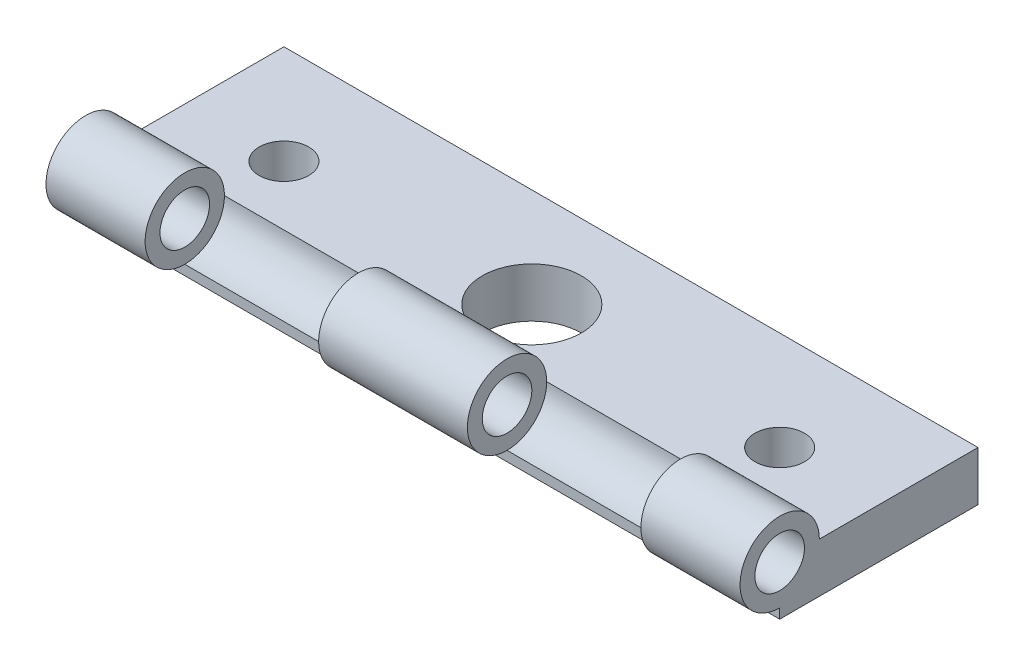
from build123d import *

# Parameters (mm, degrees)
SKETCH2_W           = 88.9
SKETCH2_H           = 25.4
SKETCH2_R           = 3.175
SKETCH2_R_2         = 6.35
BOSS_EXTRUDE1_DEPTH = 6.35
SKETCH3_R           = 5.08
CUT_EXTRUDE1_DEPTH  = 93.675198948
SKETCH4_R           = 5.08
SKETCH4_R_2         = 3.175
BOSS_EXTRUDE2_DEPTH = 12.7
SKETCH5_R           = 5.08
SKETCH5_R_2         = 3.175
BOSS_EXTRUDE3_DEPTH = 9.525


with BuildPart() as part:
    # Sketch2 → Boss-Extrude1 (new body)
    with BuildSketch(Plane(origin=(0, 0, 0), x_dir=(1, 0, 0), z_dir=(0, 1, 0))):
        with Locations((0, 12.7)):
            Rectangle(SKETCH2_W, SKETCH2_H)
        with Locations((-31.75, 12.7)):
            Circle(SKETCH2_R, mode=Mode.SUBTRACT)
        with Locations((0, 12.7)):
            Circle(SKETCH2_R_2, mode=Mode.SUBTRACT)
        with Locations((31.75, 12.7)):
            Circle(SKETCH2_R, mode=Mode.SUBTRACT)
    extrude(amount=BOSS_EXTRUDE1_DEPTH)

    # Sketch3 → Cut-Extrude1 (cut, through all)
    with BuildSketch(Plane.ZY.offset(44.45)):
        with Locations((0, 6.35)):
            Circle(SKETCH3_R)
    extrude(amount=-CUT_EXTRUDE1_DEPTH, mode=Mode.SUBTRACT)

    # Sketch4 → Boss-Extrude2 (add)
    with BuildSketch(Plane.ZY.offset(44.45)):
        with Locations((0, 6.35)):
            Circle(SKETCH4_R)
        with Locations((0, 6.35)):
            Circle(SKETCH4_R_2, mode=Mode.SUBTRACT)
    boss_extrude2 = extrude(amount=-BOSS_EXTRUDE2_DEPTH)

    # Mirror1: Boss-Extrude2 across plane
    add(boss_extrude2.mirror(Plane(origin=(0, 0, 0), x_dir=(0, 0, 1), z_dir=(1, 0, 0))))

    # Sketch5 → Boss-Extrude3 (add, symmetric)
    with BuildSketch(Plane(origin=(0, 0, 0), x_dir=(0, 0, -1), z_dir=(1, 0, 0))):
        with Locations((0, 6.35)):
            Circle(SKETCH5_R)
        with Locations((0, 6.35)):
            Circle(SKETCH5_R_2, mode=Mode.SUBTRACT)
    extrude(amount=BOSS_EXTRUDE3_DEPTH, both=True)


solid = part.part
